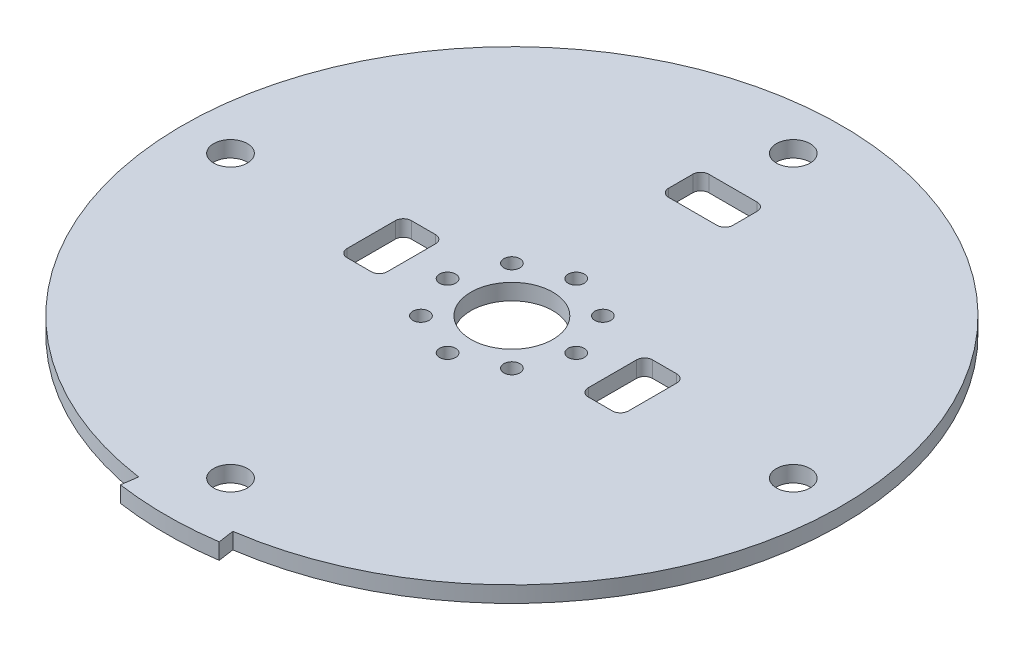
from build123d import *

# Parameters (mm, degrees)
SM_BASE_FLANGE_1_DEPTH = 2
CUT_EXTRUDE_1_REACH    = 61.447
SKETCH_6_R             = 2.1
SKETCH_6_R_2           = 5.1
SKETCH_6_R_3           = 1
SKETCH_6_W             = 8
SKETCH_6_H             = 5
SKETCH_6_W_2           = 5
SKETCH_6_H_2           = 8
FILLET_1_R             = 1


# Sheet-metal steps are written as plain solids
with BuildPart() as part:
    # Sketch 1 → 基体-法兰1 (new body)
    with BuildSketch(Plane(origin=(0, 0, 0), x_dir=(1, 0, 0), z_dir=(0, 1, 0))):
        with BuildLine():
            Line((-6.14057756, -42.559291667), (-5.854969301, -40.579789729))
            ThreePointArc((-5.854969301, -40.579789729), (-0.00413932, 40.999999791), (5.863162974, -40.578606678))
            Line((5.863162974, -40.578606678), (6.149170924, -42.558050906))
            ThreePointArc((6.149170924, -42.558050906), (0.004341238, -42.999999781), (-6.14057756, -42.559291667))
        make_face()
    extrude(amount=-SM_BASE_FLANGE_1_DEPTH)

    # 草图6 → 切除-拉伸1 (cut, up to next)
    with BuildSketch(Plane(origin=(0, 0, 0), x_dir=(1, 0, 0), z_dir=(0, 1, 0)), mode=Mode.PRIVATE) as cut_extrude_1_sk1:
        with Locations(Location((0, 35, 0), (0, 0, 270))):
            Circle(SKETCH_6_R)
    cut_extrude_1_tool1 = extrude(cut_extrude_1_sk1.sketch, amount=-CUT_EXTRUDE_1_REACH, mode=Mode.PRIVATE) & part.part
    # 草图6 → 切除-拉伸1 (cut, up to next)
    with BuildSketch(Plane(origin=(0, 0, 0), x_dir=(1, 0, 0), z_dir=(0, 1, 0)), mode=Mode.PRIVATE) as cut_extrude_1_sk2:
        with Locations(Location((35, 0, 0), (0, 0, 270))):
            Circle(SKETCH_6_R)
    cut_extrude_1_tool2 = extrude(cut_extrude_1_sk2.sketch, amount=-CUT_EXTRUDE_1_REACH, mode=Mode.PRIVATE) & part.part
    # 草图6 → 切除-拉伸1 (cut, up to next)
    with BuildSketch(Plane(origin=(0, 0, 0), x_dir=(1, 0, 0), z_dir=(0, 1, 0)), mode=Mode.PRIVATE) as cut_extrude_1_sk3:
        with Locations(Location((0, -35, 0), (0, 0, 270))):
            Circle(SKETCH_6_R)
    cut_extrude_1_tool3 = extrude(cut_extrude_1_sk3.sketch, amount=-CUT_EXTRUDE_1_REACH, mode=Mode.PRIVATE) & part.part
    # 草图6 → 切除-拉伸1 (cut, up to next)
    with BuildSketch(Plane(origin=(0, 0, 0), x_dir=(1, 0, 0), z_dir=(0, 1, 0)), mode=Mode.PRIVATE) as cut_extrude_1_sk4:
        with Locations(Location((-35, 0, 0), (0, 0, 270))):
            Circle(SKETCH_6_R)
    cut_extrude_1_tool4 = extrude(cut_extrude_1_sk4.sketch, amount=-CUT_EXTRUDE_1_REACH, mode=Mode.PRIVATE) & part.part
    # 草图6 → 切除-拉伸1 (cut, up to next)
    with BuildSketch(Plane(origin=(0, 0, 0), x_dir=(1, 0, 0), z_dir=(0, 1, 0)), mode=Mode.PRIVATE) as cut_extrude_1_sk5:
        with Locations(Location((0, 0, 0), (0, 0, 270))):
            Circle(SKETCH_6_R_2)
    cut_extrude_1_tool5 = extrude(cut_extrude_1_sk5.sketch, amount=-CUT_EXTRUDE_1_REACH, mode=Mode.PRIVATE) & part.part
    # 草图6 → 切除-拉伸1 (cut, up to next)
    with BuildSketch(Plane(origin=(0, 0, 0), x_dir=(1, 0, 0), z_dir=(0, 1, 0)), mode=Mode.PRIVATE) as cut_extrude_1_sk6:
        with Locations(Location((0, 8, 0), (0, 0, 270))):
            Circle(SKETCH_6_R_3)
    cut_extrude_1_tool6 = extrude(cut_extrude_1_sk6.sketch, amount=-CUT_EXTRUDE_1_REACH, mode=Mode.PRIVATE) & part.part
    # 草图6 → 切除-拉伸1 (cut, up to next)
    with BuildSketch(Plane(origin=(0, 0, 0), x_dir=(1, 0, 0), z_dir=(0, 1, 0)), mode=Mode.PRIVATE) as cut_extrude_1_sk7:
        with Locations(Location((5.656854249, 5.656854249, 0), (0, 0, 270))):
            Circle(SKETCH_6_R_3)
    cut_extrude_1_tool7 = extrude(cut_extrude_1_sk7.sketch, amount=-CUT_EXTRUDE_1_REACH, mode=Mode.PRIVATE) & part.part
    # 草图6 → 切除-拉伸1 (cut, up to next)
    with BuildSketch(Plane(origin=(0, 0, 0), x_dir=(1, 0, 0), z_dir=(0, 1, 0)), mode=Mode.PRIVATE) as cut_extrude_1_sk8:
        with Locations(Location((8, 0, 0), (0, 0, 270))):
            Circle(SKETCH_6_R_3)
    cut_extrude_1_tool8 = extrude(cut_extrude_1_sk8.sketch, amount=-CUT_EXTRUDE_1_REACH, mode=Mode.PRIVATE) & part.part
    # 草图6 → 切除-拉伸1 (cut, up to next)
    with BuildSketch(Plane(origin=(0, 0, 0), x_dir=(1, 0, 0), z_dir=(0, 1, 0)), mode=Mode.PRIVATE) as cut_extrude_1_sk9:
        with Locations(Location((5.656854249, -5.656854249, 0), (0, 0, 270))):
            Circle(SKETCH_6_R_3)
    cut_extrude_1_tool9 = extrude(cut_extrude_1_sk9.sketch, amount=-CUT_EXTRUDE_1_REACH, mode=Mode.PRIVATE) & part.part
    # 草图6 → 切除-拉伸1 (cut, up to next)
    with BuildSketch(Plane(origin=(0, 0, 0), x_dir=(1, 0, 0), z_dir=(0, 1, 0)), mode=Mode.PRIVATE) as cut_extrude_1_sk10:
        with Locations(Location((0, -8, 0), (0, 0, 270))):
            Circle(SKETCH_6_R_3)
    cut_extrude_1_tool10 = extrude(cut_extrude_1_sk10.sketch, amount=-CUT_EXTRUDE_1_REACH, mode=Mode.PRIVATE) & part.part
    # 草图6 → 切除-拉伸1 (cut, up to next)
    with BuildSketch(Plane(origin=(0, 0, 0), x_dir=(1, 0, 0), z_dir=(0, 1, 0)), mode=Mode.PRIVATE) as cut_extrude_1_sk11:
        with Locations(Location((-5.656854249, -5.656854249, 0), (0, 0, 270))):
            Circle(SKETCH_6_R_3)
    cut_extrude_1_tool11 = extrude(cut_extrude_1_sk11.sketch, amount=-CUT_EXTRUDE_1_REACH, mode=Mode.PRIVATE) & part.part
    # 草图6 → 切除-拉伸1 (cut, up to next)
    with BuildSketch(Plane(origin=(0, 0, 0), x_dir=(1, 0, 0), z_dir=(0, 1, 0)), mode=Mode.PRIVATE) as cut_extrude_1_sk12:
        with Locations(Location((-8, 0, 0), (0, 0, 270))):
            Circle(SKETCH_6_R_3)
    cut_extrude_1_tool12 = extrude(cut_extrude_1_sk12.sketch, amount=-CUT_EXTRUDE_1_REACH, mode=Mode.PRIVATE) & part.part
    # 草图6 → 切除-拉伸1 (cut, up to next)
    with BuildSketch(Plane(origin=(0, 0, 0), x_dir=(1, 0, 0), z_dir=(0, 1, 0)), mode=Mode.PRIVATE) as cut_extrude_1_sk13:
        with Locations(Location((-5.656854249, 5.656854249, 0), (0, 0, 270))):
            Circle(SKETCH_6_R_3)
    cut_extrude_1_tool13 = extrude(cut_extrude_1_sk13.sketch, amount=-CUT_EXTRUDE_1_REACH, mode=Mode.PRIVATE) & part.part
    # 草图6 → 切除-拉伸1 (cut, up to next)
    with BuildSketch(Plane(origin=(0, 0, 0), x_dir=(1, 0, 0), z_dir=(0, 1, 0)), mode=Mode.PRIVATE) as cut_extrude_1_sk14:
        with Locations((0, 25)):
            Rectangle(SKETCH_6_W, SKETCH_6_H)
    cut_extrude_1_tool14 = extrude(cut_extrude_1_sk14.sketch, amount=-CUT_EXTRUDE_1_REACH, mode=Mode.PRIVATE) & part.part
    # 草图6 → 切除-拉伸1 (cut, up to next)
    with BuildSketch(Plane(origin=(0, 0, 0), x_dir=(1, 0, 0), z_dir=(0, 1, 0)), mode=Mode.PRIVATE) as cut_extrude_1_sk15:
        with Locations((15, 0)):
            Rectangle(SKETCH_6_W_2, SKETCH_6_H_2)
    cut_extrude_1_tool15 = extrude(cut_extrude_1_sk15.sketch, amount=-CUT_EXTRUDE_1_REACH, mode=Mode.PRIVATE) & part.part
    # 草图6 → 切除-拉伸1 (cut, up to next)
    with BuildSketch(Plane(origin=(0, 0, 0), x_dir=(1, 0, 0), z_dir=(0, 1, 0)), mode=Mode.PRIVATE) as cut_extrude_1_sk16:
        with Locations((-15, 0)):
            Rectangle(SKETCH_6_W_2, SKETCH_6_H_2)
    cut_extrude_1_tool16 = extrude(cut_extrude_1_sk16.sketch, amount=-CUT_EXTRUDE_1_REACH, mode=Mode.PRIVATE) & part.part
    add(cut_extrude_1_tool1.solids().sort_by_distance((0, 0, -35))[0], mode=Mode.SUBTRACT)
    add(cut_extrude_1_tool2.solids().sort_by_distance((35, 0, 0))[0], mode=Mode.SUBTRACT)
    add(cut_extrude_1_tool3.solids().sort_by_distance((0, 0, 35))[0], mode=Mode.SUBTRACT)
    add(cut_extrude_1_tool4.solids().sort_by_distance((-35, 0, 0))[0], mode=Mode.SUBTRACT)
    add(cut_extrude_1_tool5.solids().sort_by_distance((0, 0, 0))[0], mode=Mode.SUBTRACT)
    add(cut_extrude_1_tool6.solids().sort_by_distance((0, 0, -8))[0], mode=Mode.SUBTRACT)
    add(cut_extrude_1_tool7.solids().sort_by_distance((5.656854, 0, -5.656854))[0], mode=Mode.SUBTRACT)
    add(cut_extrude_1_tool8.solids().sort_by_distance((8, 0, 0))[0], mode=Mode.SUBTRACT)
    add(cut_extrude_1_tool9.solids().sort_by_distance((5.656854, 0, 5.656854))[0], mode=Mode.SUBTRACT)
    add(cut_extrude_1_tool10.solids().sort_by_distance((0, 0, 8))[0], mode=Mode.SUBTRACT)
    add(cut_extrude_1_tool11.solids().sort_by_distance((-5.656854, 0, 5.656854))[0], mode=Mode.SUBTRACT)
    add(cut_extrude_1_tool12.solids().sort_by_distance((-8, 0, 0))[0], mode=Mode.SUBTRACT)
    add(cut_extrude_1_tool13.solids().sort_by_distance((-5.656854, 0, -5.656854))[0], mode=Mode.SUBTRACT)
    add(cut_extrude_1_tool14.solids().sort_by_distance((0, 0, -25))[0], mode=Mode.SUBTRACT)
    add(cut_extrude_1_tool15.solids().sort_by_distance((15, 0, 0))[0], mode=Mode.SUBTRACT)
    add(cut_extrude_1_tool16.solids().sort_by_distance((-15, 0, 0))[0], mode=Mode.SUBTRACT)

    # 圆角1
    fillet_1_edges = [part.edges().sort_by_distance(p)[0] for p in [
        (-17.5, -1, 4),
        (-17.5, -1, -4),
        (-12.5, -1, -4),
        (-12.5, -1, 4),
        (12.5, -1, 4),
        (12.5, -1, -4),
        (17.5, -1, -4),
        (17.5, -1, 4),
        (-4, -1, -22.5),
        (-4, -1, -27.5),
        (4, -1, -27.5),
        (4, -1, -22.5),
    ]]
    fillet(fillet_1_edges, radius=FILLET_1_R)


solid = part.part
